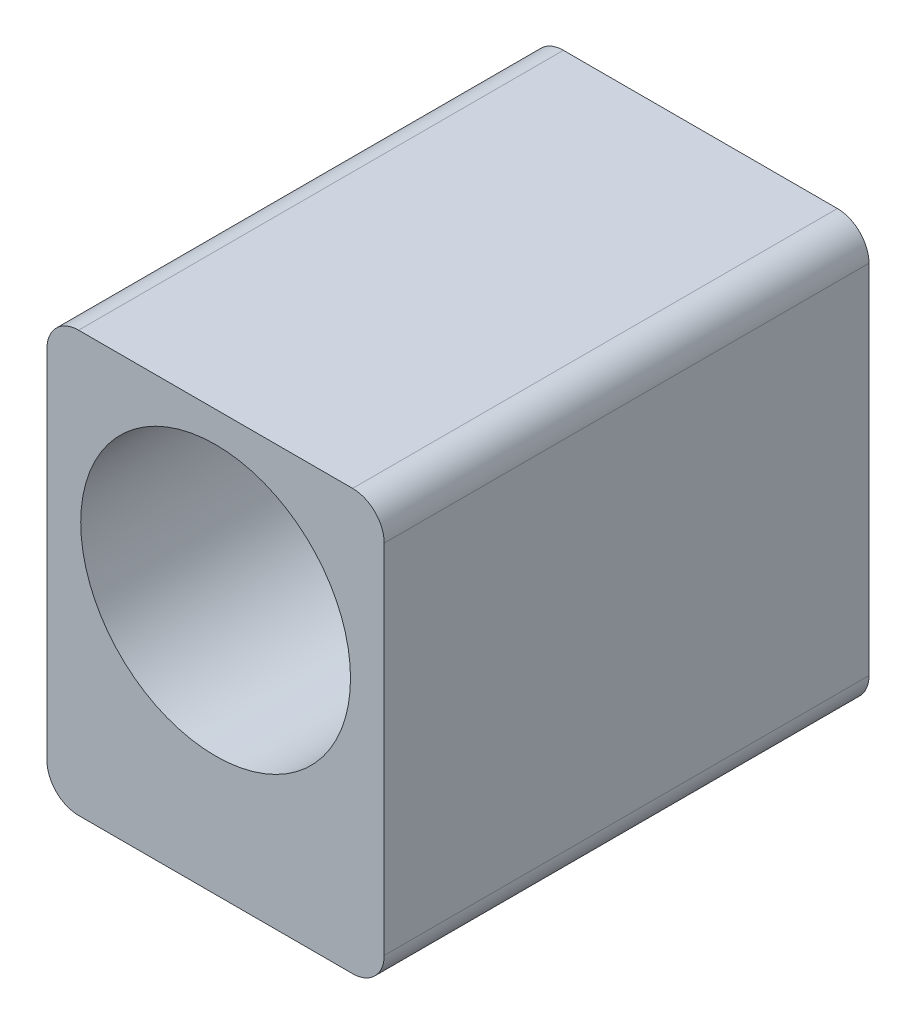
from build123d import *

# Parameters (mm, degrees)
SKETCH1_R           = 12.8
BOSS_EXTRUDE1_DEPTH = 23
SKETCH2_R           = 2
CUT_EXTRUDE1_DEPTH  = 9


with BuildPart() as part:
    # Sketch1 → Boss-Extrude1 (new, symmetric)
    with BuildSketch(Plane.XY):
        with BuildLine():
            Line((-13, -24.182), (13, -24.182))
            ThreePointArc((13, -24.182), (15.121320344, -23.303320344), (16, -21.182))
            Line((16, -21.182), (16, 12.7))
            ThreePointArc((16, 12.7), (15.121320344, 14.821320344), (13, 15.7))
            Line((13, 15.7), (-13, 15.7))
            ThreePointArc((-13, 15.7), (-15.121320344, 14.821320344), (-16, 12.7))
            Line((-16, 12.7), (-16, -21.182))
            ThreePointArc((-16, -21.182), (-15.121320344, -23.303320344), (-13, -24.182))
        make_face()
        Circle(SKETCH1_R, mode=Mode.SUBTRACT)
    extrude(amount=BOSS_EXTRUDE1_DEPTH, both=True)

    # Sketch2 → Cut-Extrude1 (cut)
    with BuildSketch(Plane(origin=(0, -24.182, 0), x_dir=(1, 0, 0), z_dir=(0, 1, 0))):
        with Locations((12, -17.5)):
            Circle(SKETCH2_R)
        with Locations((-12, 17.5)):
            Circle(SKETCH2_R)
    extrude(amount=CUT_EXTRUDE1_DEPTH, mode=Mode.SUBTRACT)


solid = part.part
